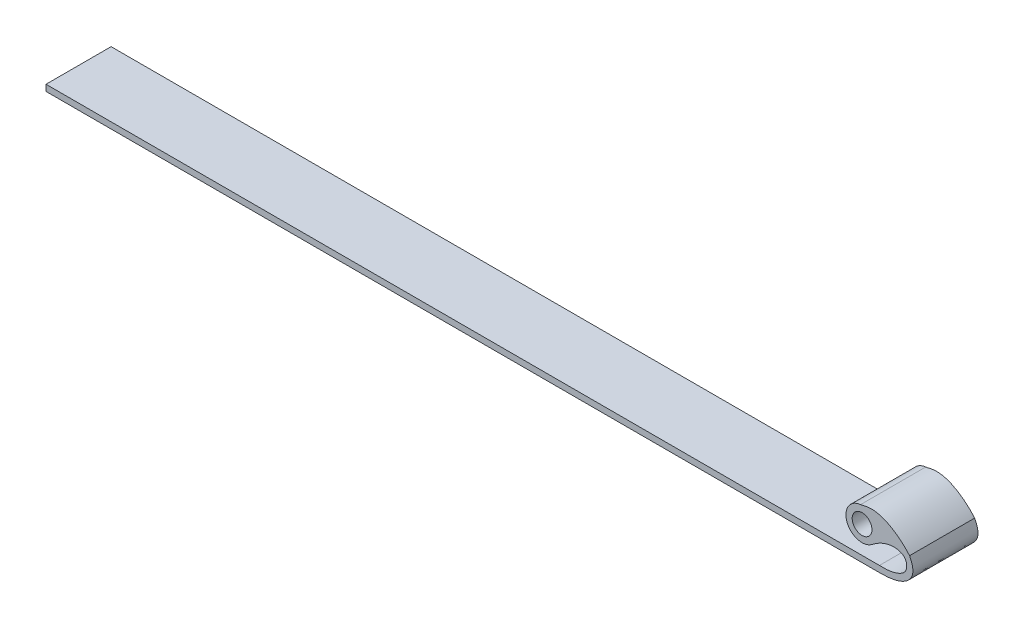
from build123d import *

# Parameters (mm, degrees)
SKETCH1_W               = 203.2
SKETCH1_H               = 15.875
BOSS_EXTRUDE1_DEPTH     = 1.524
BOSS_EXTRUDE2_START     = -15.875
BOSS_EXTRUDE2_OUTLINE_R = 2.413
BOSS_EXTRUDE2_DEPTH     = 15.875


# Read off the part's stored shape, not the designer's step: Boss-Extrude2
with BuildPart() as part:
    # Sketch1 → Boss-Extrude1 (new body)
    with BuildSketch(Plane(origin=(0, 0, 0), x_dir=(1, 0, 0), z_dir=(0, 1, 0))):
        Rectangle(SKETCH1_W, SKETCH1_H)
    extrude(amount=BOSS_EXTRUDE1_DEPTH)

    # Boss-Extrude2 outline → Boss-Extrude2 (add)
    with BuildSketch(Plane.XY.offset(7.9375).offset(BOSS_EXTRUDE2_START)):
        with BuildLine():
            add(Edge.make_bspline(
                [(107.228546138, 6.692607406), (106.366027923, 7.18125968), (105.140033894, 7.42790314), (103.583408394, 7.287922485), (101.756786703, 6.577932625), (99.786331846, 5.041015057)],
                knots=[0, 0, 0, 0, 0, 0, 1, 1, 1, 1, 1, 1], degree=5))
            ThreePointArc((107.228546138, 6.692607406), (108.258782429, 4.761783473), (107.30453503, 2.792296286))
            add(Edge.make_bspline(
                [(101.6, 1.524), (103.258114517, 1.448306251), (104.638933259, 1.583946831), (105.766741539, 1.881154947), (106.652889556, 2.297992507), (107.30453503, 2.792296286)],
                knots=[0, 0, 0, 0, 0, 0, 1, 1, 1, 1, 1, 1], degree=5))
            Line((101.6, 1.524), (101.6, 0))
            add(Edge.make_bspline(
                [(101.6, 0), (104.748480566, -0.003746591), (109.050367624, 0.259943099), (110.73800353, 3.235869603), (109.946934459, 5.044027479), (108.94689031, 7.25796652)],
                knots=[0, 0, 0, 0, 0, 0, 1, 1, 1, 1, 1, 1], degree=5))
            add(Edge.make_bspline(
                [(108.94689031, 7.25796652), (106.455515071, 10.263008134), (101.235622898, 14.016404122), (98.534099755, 12.238404022), (96.99562172, 12.065011937)],
                knots=[0, 0, 0, 0, 0, 1, 1, 1, 1, 1], degree=4))
            ThreePointArc((96.99562172, 12.065011937), (93.706192437, 6.691697876), (99.786331846, 5.041015057))
        make_face()
        with Locations((97.364988112, 8.145377073)):
            Circle(BOSS_EXTRUDE2_OUTLINE_R, mode=Mode.SUBTRACT)
    extrude(amount=BOSS_EXTRUDE2_DEPTH)


solid = part.part
